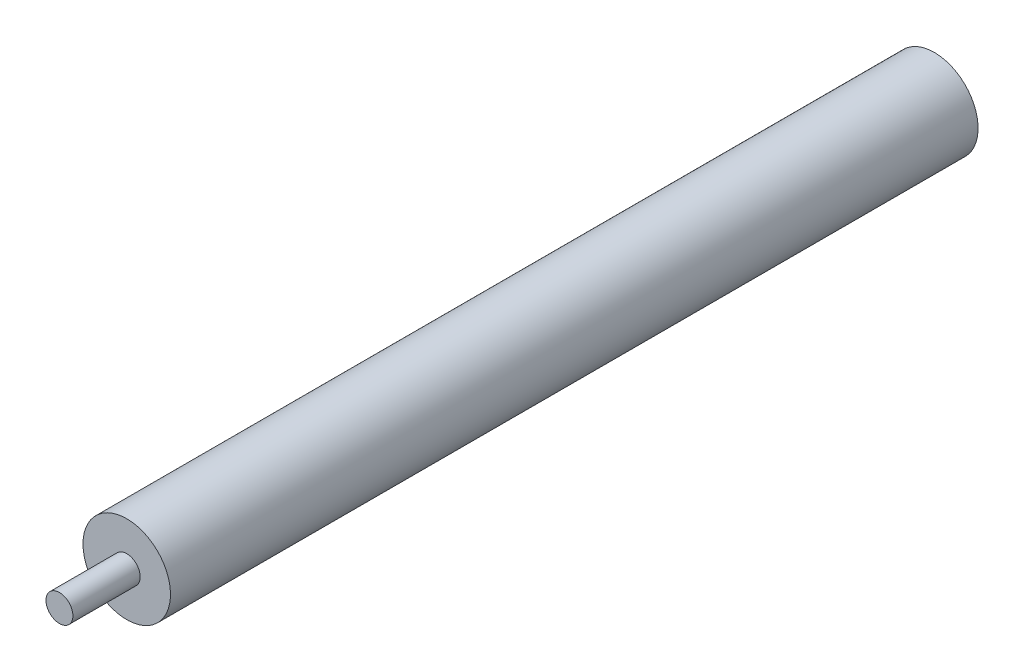
from build123d import *

# Parameters (mm, degrees)
SKETCH1_R           = 9.75
BOSS_EXTRUDE1_DEPTH = 180
SKETCH2_R           = 3
BOSS_EXTRUDE2_DEPTH = 15


with BuildPart() as part:
    # Sketch1 → Boss-Extrude1 (new body)
    with BuildSketch(Plane.XY):
        Circle(SKETCH1_R)
    extrude(amount=BOSS_EXTRUDE1_DEPTH)

    # Sketch2 → Boss-Extrude2 (add)
    with BuildSketch(Plane.XY.offset(180)):
        Circle(SKETCH2_R)
    extrude(amount=BOSS_EXTRUDE2_DEPTH)


solid = part.part
